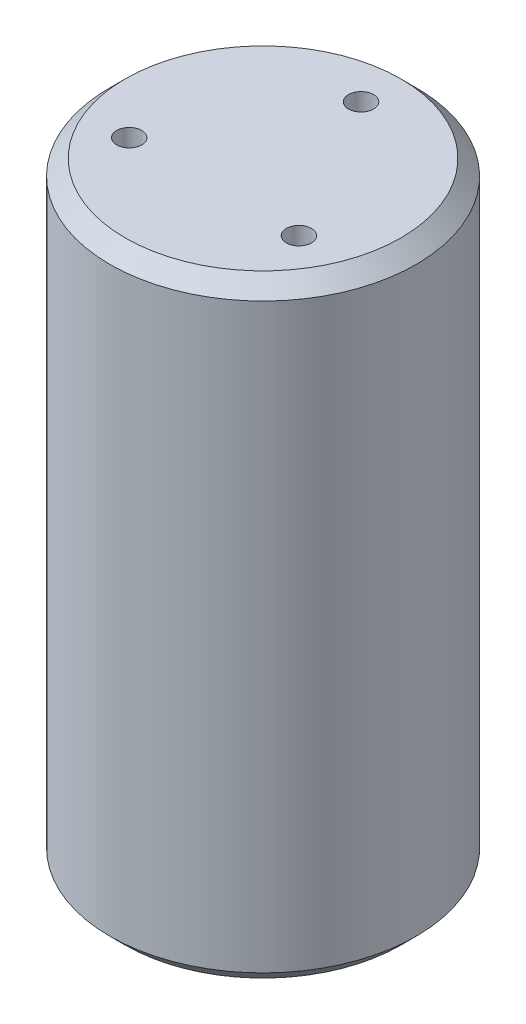
from build123d import *

# Parameters (mm, degrees)
SKETCH_1_R          = 25
EXTRUDE_1_DEPTH     = 100
SKETCH_2_R          = 2.05
CUT_EXTRUDE_1_DEPTH = 5
CHAMFER_1_SIZE      = 2.5
CUT_EXTRUDE_START   = -5
SKETCH_3_R          = 2.05
CUT_EXTRUDE_2_DEPTH = 5


with BuildPart() as part:
    # ｽｹｯﾁ1 → ﾎﾞｽ - 押し出し1 (new body)
    with BuildSketch(Plane(origin=(0, 0, 0), x_dir=(1, 0, 0), z_dir=(0, 1, 0))):
        Circle(SKETCH_1_R)
    extrude(amount=EXTRUDE_1_DEPTH)

    # ｽｹｯﾁ2 → ｶｯﾄ - 押し出し1 (cut)
    with BuildSketch(Plane(origin=(0, 100, 0), x_dir=(1, 0, 0), z_dir=(0, 1, 0))):
        with Locations((0, 16)):
            Circle(SKETCH_2_R)
        with Locations((13.856406461, -8)):
            Circle(SKETCH_2_R)
        with Locations((-13.856406461, -8)):
            Circle(SKETCH_2_R)
    extrude(amount=-CUT_EXTRUDE_1_DEPTH, mode=Mode.SUBTRACT)

    # 面取り1
    chamfer_1_edges = [part.edges().sort_by_distance(p)[0] for p in [
        (-25, 0, 0),
        (-25, 100, 0),
    ]]
    chamfer(chamfer_1_edges, length=CHAMFER_1_SIZE)

    # ｽｹｯﾁ3 → ｶｯﾄ - 押し出し2 (cut)
    with BuildSketch(Plane.XZ.offset(CUT_EXTRUDE_START)):
        with Locations((0, -16)):
            Circle(SKETCH_3_R)
        with Locations((-13.856406461, 8)):
            Circle(SKETCH_3_R)
        with Locations((13.856406461, 8)):
            Circle(SKETCH_3_R)
    extrude(amount=CUT_EXTRUDE_2_DEPTH, mode=Mode.SUBTRACT)


solid = part.part
